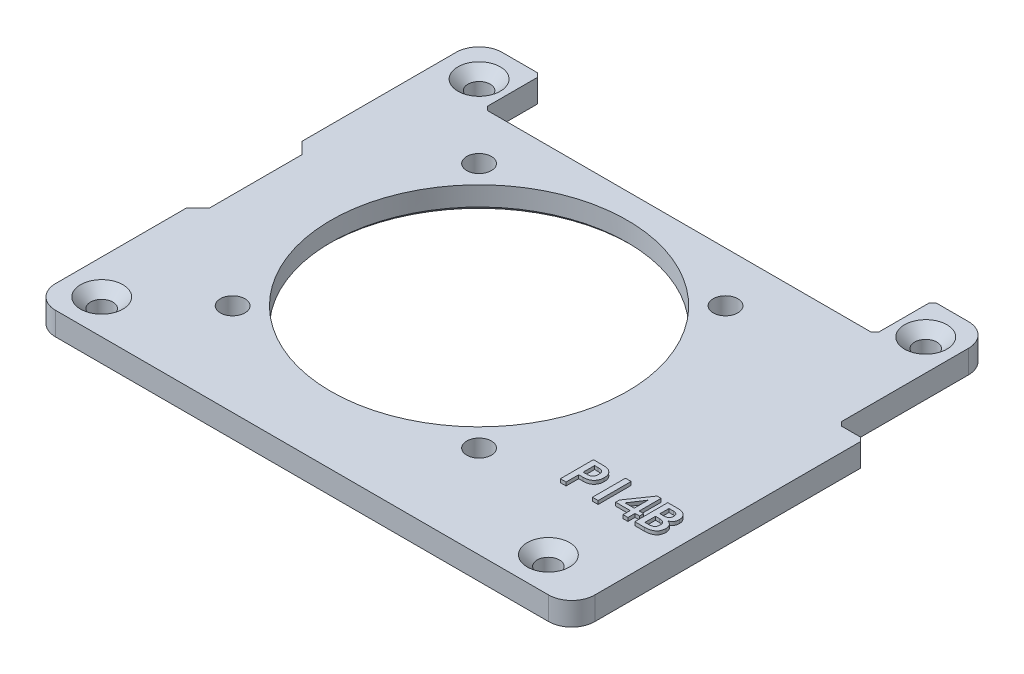
from build123d import *

# Parameters (mm, degrees)
EXTRUDE_1_DEPTH                = 3
HOLE_WIZARD_M2_5_1_D           = 2.9
HOLE_WIZARD_M2_5_1_CSINK_D     = 5.5
HOLE_WIZARD_M2_5_1_CSINK_ANGLE = 90
SKETCH_7_W                     = 50.8
SKETCH_7_H                     = 7.5
CUT_EXTRUDE_1_DEPTH            = 91.979123429
SKETCH_8_R                     = 19.25
SKETCH_8_R_2                   = 1.6
CUT_EXTRUDE_2_DEPTH            = 91.979123429
FILLET_2_R                     = 3
CHAMFER_1_SIZE                 = 0.5
CHAMFER_2_SIZE                 = 0.5
SKETCH_9_W                     = 1.5
SKETCH_9_H                     = 15
CUT_EXTRUDE_3_DEPTH            = 91.979123429
CHAMFER_3_SIZE                 = 1.5
SKETCH_10_W                    = 0.736350545
SKETCH_10_H                    = 4.28296778
EXTRUDE_2_DEPTH                = 0.45


with BuildPart() as part:
    # 草图1 → 凸台-拉伸1 (new body)
    with BuildSketch(Plane(origin=(0, 0, 0), x_dir=(1, 0, 0), z_dir=(0, 1, 0))):
        Polygon((70.03, 0), (70.03, 38), (66.55, 38), (66.55, 58), (0, 58), (0, 0), align=None)
    extrude(amount=EXTRUDE_1_DEPTH)

    # M2.5 锥坑平头螺钉的锥形沉头孔1 (through all)
    with Locations(Plane(origin=(0, 3, 0), x_dir=(1, 0, 0), z_dir=(0, 1, 0))):
        with Locations((4.5, 4.5), (4.5, 53.5), (62.5, 53.5), (62.5, 4.5)):
            CounterSinkHole(HOLE_WIZARD_M2_5_1_D / 2, HOLE_WIZARD_M2_5_1_CSINK_D / 2, counter_sink_angle=HOLE_WIZARD_M2_5_1_CSINK_ANGLE)

    # 草图7 → 切除-拉伸1 (cut, through all)
    with BuildSketch(Plane(origin=(0, 3, 0), x_dir=(1, 0, 0), z_dir=(0, 1, 0))):
        with Locations((33.5, 54.25)):
            Rectangle(SKETCH_7_W, SKETCH_7_H)
    extrude(amount=-CUT_EXTRUDE_1_DEPTH, mode=Mode.SUBTRACT)

    # 草图8 → 切除-拉伸2 (cut, through all)
    with BuildSketch(Plane(origin=(0, 3, 0), x_dir=(1, 0, 0), z_dir=(0, 1, 0))):
        with Locations(Location((30, 28, 0), (0, 0, 270))):
            Circle(SKETCH_8_R)
        with Locations(Location((14, 44, 0), (0, 0, 270))):
            Circle(SKETCH_8_R_2)
        with Locations(Location((46, 44, 0), (0, 0, 270))):
            Circle(SKETCH_8_R_2)
        with Locations(Location((14, 12, 0), (0, 0, 270))):
            Circle(SKETCH_8_R_2)
        with Locations(Location((46, 12, 0), (0, 0, 270))):
            Circle(SKETCH_8_R_2)
    extrude(amount=-CUT_EXTRUDE_2_DEPTH, mode=Mode.SUBTRACT)

    # 圆角2
    fillet_2_edges = [part.edges().sort_by_distance(p)[0] for p in [
        (0, 1.5, -58),
        (66.55, 1.5, -58),
        (70.03, 1.5, 0),
        (0, 1.5, 0),
    ]]
    fillet(fillet_2_edges, radius=FILLET_2_R)

    # 倒角1
    chamfer_1_edges = [part.edges().sort_by_distance(p)[0] for p in [
        (66.55, 1.5, -38),
        (70.03, 1.5, -38),
        (8.1, 1.5, -50.5),
        (8.1, 1.5, -58),
        (58.9, 1.5, -58),
        (58.9, 1.5, -50.5),
    ]]
    chamfer(chamfer_1_edges, length=CHAMFER_1_SIZE)

    # 倒角2
    chamfer_2_edges = [part.edges().sort_by_distance(p)[0] for p in [
        (30, 0, -47.25),
    ]]
    chamfer(chamfer_2_edges, length=CHAMFER_2_SIZE)

    # 草图9 → 切除-拉伸3 (cut, through all)
    with BuildSketch(Plane(origin=(0, 3, 0), x_dir=(1, 0, 0), z_dir=(0, 1, 0))):
        with Locations((0.75, 27.5)):
            Rectangle(SKETCH_9_W, SKETCH_9_H)
    extrude(amount=-CUT_EXTRUDE_3_DEPTH, mode=Mode.SUBTRACT)

    # 倒角3
    chamfer_3_edges = [part.edges().sort_by_distance(p)[0] for p in [
        (1.5, 1.5, -20),
        (1.5, 1.5, -35),
    ]]
    chamfer(chamfer_3_edges, length=CHAMFER_3_SIZE - 0.0001)  # a hair under: the kernel refuses the full size

    # 草图10 → 凸台-拉伸2 (add)
    # profile 1 of 4: a face of its own
    with BuildSketch(Plane(origin=(0, 3, 0), x_dir=(1, 0, 0), z_dir=(0, 1, 0))):
        with BuildLine():
            add(Edge.make_bspline(
                [(57.909075927, 16.34371961), (57.908149164, 16.295550669), (57.906330534, 16.201026562), (57.888155166, 16.062953132), (57.860253997, 15.931625506), (57.81949143, 15.807891256), (57.767618475, 15.691257064), (57.705173618, 15.581114679), (57.629827056, 15.478471088), (57.5436965, 15.383172643), (57.447425045, 15.296541062), (57.340774288, 15.221349211), (57.223860837, 15.158726364), (57.097414295, 15.10743544), (56.961738841, 15.066715289), (56.81634825, 15.038838133), (56.66175021, 15.020790382), (56.555322858, 15.019015364), (56.500725071, 15.01810477)],
                knots=[0, 0, 0, 0, 1.055941234, 2.072121589, 3.048957332, 3.996857081, 4.923552649, 5.844699312, 6.768221172, 7.710385292, 8.657546142, 9.602916946, 10.565193964, 11.559900134, 12.591170482, 13.666713964, 14.803012066, 16, 16, 16, 16], degree=3))
            Line((56.500725071, 15.01810477), (55.911460777, 15.01810477))
            Line((55.911460777, 15.01810477), (55.911460777, 13.38636667))
            Line((55.911460777, 13.38636667), (55.175110231, 13.38636667))
            Line((55.175110231, 13.38636667), (55.175110231, 17.66933445))
            Line((55.175110231, 17.66933445), (56.500725071, 17.66933445))
            add(Edge.make_bspline(
                [(56.500725071, 17.66933445), (56.555322758, 17.668423422), (56.661749915, 17.666647558), (56.816349336, 17.648605799), (56.961735073, 17.620707569), (57.09715551, 17.580142798), (57.223428003, 17.528680492), (57.33960435, 17.465023774), (57.446545308, 17.390043228), (57.542748872, 17.30331987), (57.628980647, 17.208093731), (57.704086938, 17.105132323), (57.767806232, 16.995546782), (57.819420831, 16.878588865), (57.860281159, 16.754906452), (57.888055184, 16.623857602), (57.906388549, 16.486115374), (57.90816681, 16.391890869), (57.909075927, 16.34371961)],
                knots=[0, 0, 0, 0, 1.197461093, 2.334208364, 3.410176999, 4.441854999, 5.43073401, 6.396602736, 7.342347237, 8.289882492, 9.232419041, 10.156305961, 11.081170954, 12.008232837, 12.956507283, 13.93372916, 14.943641362, 16, 16, 16, 16], degree=3))
        make_face()
        with BuildLine():
            add(Edge.make_bspline(
                [(57.172725381, 16.34371961), (57.172411975, 16.378376569), (57.171808617, 16.44509682), (57.161246686, 16.540617665), (57.145802096, 16.627597671), (57.125286604, 16.706538706), (57.096856996, 16.776715492), (57.061814536, 16.837897871), (57.020965378, 16.890632378), (56.972944383, 16.934326077), (56.918793051, 16.971714381), (56.857334845, 17.002317059), (56.790359376, 17.030333187), (56.716079656, 17.052305783), (56.635084639, 17.068368716), (56.547582267, 17.08020363), (56.453354479, 17.087628975), (56.3882796, 17.0887053), (56.354558109, 17.089263046)],
                knots=[0, 0, 0, 0, 1.287087184, 2.477851002, 3.56551051, 4.568137571, 5.502703185, 6.369845782, 7.180743627, 7.970419851, 8.772637866, 9.617977299, 10.516617182, 11.467615524, 12.490341929, 13.582105939, 14.747058877, 16, 16, 16, 16], degree=3))
            Line((56.354558109, 17.089263046), (55.911460777, 17.089263046))
            Line((55.911460777, 17.089263046), (55.911460777, 15.599095463))
            Line((55.911460777, 15.599095463), (56.354558109, 15.599095463))
            add(Edge.make_bspline(
                [(56.354558109, 15.599095463), (56.388278429, 15.599665013), (56.453656556, 15.600769277), (56.548203866, 15.608086485), (56.635990612, 15.620025206), (56.717042911, 15.635946927), (56.791020705, 15.658345242), (56.858294388, 15.684645548), (56.918928425, 15.716067179), (56.972967431, 15.753064721), (57.020959075, 15.796820085), (57.061816371, 15.849537493), (57.096856448, 15.910724879), (57.125286768, 15.980900171), (57.145802047, 16.059841652), (57.161246701, 16.146821523), (57.171808613, 16.242342408), (57.172411974, 16.309062654), (57.172725381, 16.34371961)],
                knots=[0, 0, 0, 0, 1.253177668, 2.4297043, 3.521674426, 4.544593913, 5.495771796, 6.390314524, 7.225705931, 8.028075398, 8.817900706, 9.628951643, 10.496257949, 11.431000001, 12.433816351, 13.5216812, 14.712669824, 16, 16, 16, 16], degree=3))
        make_face(mode=Mode.SUBTRACT)
    # profile 2 of 4: a face of its own
    with BuildSketch(Plane(origin=(0, 3, 0), x_dir=(1, 0, 0), z_dir=(0, 1, 0))):
        with Locations((59.704907127, 15.52785056)):
            Rectangle(SKETCH_10_W, SKETCH_10_H)
    # profile 3 of 4: a face of its own
    with BuildSketch(Plane(origin=(0, 3, 0), x_dir=(1, 0, 0), z_dir=(0, 1, 0))):
        Polygon((63.278643388, 14.33599228), (61.403293684, 14.33599228), (61.403293684, 14.827811933), (63.403666702, 17.71805677), (63.918468581, 17.71805677), (63.918468581, 14.868260652), (64.50313643, 14.868260652), (64.50313643, 14.33599228), (63.918468581, 14.33599228), (63.918468581, 13.410268186), (63.278643388, 13.410268186), align=None)
        Polygon((63.278643388, 14.868260652), (63.278643388, 16.674663675), (62.090921909, 14.868260652), align=None, mode=Mode.SUBTRACT)
    # profile 4 of 4: a face of its own
    with BuildSketch(Plane(origin=(0, 3, 0), x_dir=(1, 0, 0), z_dir=(0, 1, 0))):
        with BuildLine():
            add(Edge.make_bspline(
                [(67.616768512, 14.687160705), (67.61570754, 14.629486875), (67.61365747, 14.518046359), (67.593100612, 14.35768385), (67.560326172, 14.210387533), (67.514883931, 14.07600626), (67.45482098, 13.955399642), (67.381442102, 13.848382804), (67.295142895, 13.754101714), (67.194994795, 13.674446549), (67.084824838, 13.606899619), (66.967446319, 13.548069667), (66.843281975, 13.496917898), (66.710945005, 13.457244801), (66.571745424, 13.424229105), (66.424630521, 13.40338733), (66.270306161, 13.388715117), (66.164942186, 13.387162134), (66.110973015, 13.38636667)],
                knots=[0, 0, 0, 0, 1.214216004, 2.346174309, 3.398354795, 4.388279313, 5.326350126, 6.226833345, 7.112954168, 8.008031957, 8.912461697, 9.830332446, 10.771174523, 11.736815783, 12.73722573, 13.781438273, 14.863615984, 16, 16, 16, 16], degree=3))
            Line((66.110973015, 13.38636667), (64.834080496, 13.38636667))
            Line((64.834080496, 13.38636667), (64.834080496, 17.66933445))
            Line((64.834080496, 17.66933445), (66.159695336, 17.66933445))
            add(Edge.make_bspline(
                [(66.159695336, 17.66933445), (66.214267317, 17.668215827), (66.319969411, 17.666049134), (66.47329545, 17.651108459), (66.615314185, 17.62265873), (66.747760168, 17.587212966), (66.868568972, 17.537839445), (66.979146143, 17.479176573), (67.078528599, 17.408596263), (67.166182053, 17.327717191), (67.242848004, 17.240189149), (67.310688354, 17.149822573), (67.36799805, 17.056075901), (67.41404831, 16.958443667), (67.451296665, 16.858393733), (67.477195494, 16.754511299), (67.491815743, 16.647503867), (67.494213207, 16.575116889), (67.495422355, 16.538608893)],
                knots=[0, 0, 0, 0, 1.33113717, 2.578319164, 3.750959862, 4.860775065, 5.916972853, 6.926855544, 7.90778062, 8.88113087, 9.828922234, 10.742256505, 11.634396839, 12.503607127, 13.37140239, 14.234259165, 15.109457783, 16, 16, 16, 16], degree=3))
            add(Edge.make_bspline(
                [(67.495422355, 16.538608893), (67.494678703, 16.502731817), (67.493232814, 16.432975717), (67.483138787, 16.331532118), (67.46629843, 16.236916962), (67.440689606, 16.149518079), (67.410484282, 16.068486993), (67.37095319, 15.995275896), (67.326039069, 15.92811808), (67.257526088, 15.851685264), (67.169107808, 15.772178145), (67.064280594, 15.696200089), (66.96313452, 15.643071194), (66.894339174, 15.627535044), (66.862032185, 15.620239111)],
                knots=[0, 0, 0, 0, 1.066354622, 2.073322247, 3.027359755, 3.918209834, 4.777534225, 5.592506442, 6.385810961, 7.17328942, 8.6370913, 9.910926524, 11.018950027, 12, 12, 12, 12], degree=3))
            add(Edge.make_bspline(
                [(66.862032185, 15.620239111), (66.904822235, 15.611449278), (66.993284672, 15.593277526), (67.121520403, 15.532212149), (67.248059385, 15.445145798), (67.348791353, 15.35361149), (67.426908321, 15.270593261), (67.476848077, 15.200053054), (67.521207014, 15.126206898), (67.555417576, 15.046761355), (67.583706987, 14.963613217), (67.602525886, 14.875363896), (67.614993063, 14.78281941), (67.616170544, 14.719378385), (67.616768512, 14.687160705)],
                knots=[0, 0, 0, 0, 1.203910315, 2.488916061, 3.891524143, 5.439134463, 6.242555454, 7.037221142, 7.823170937, 8.619595385, 9.423194974, 10.247336316, 11.109933089, 12, 12, 12, 12], degree=3))
        make_face()
        with BuildLine():
            add(Edge.make_bspline(
                [(66.75815252, 16.538608893), (66.757581369, 16.56191634), (66.756481144, 16.606814099), (66.74924731, 16.671783012), (66.736526395, 16.731919657), (66.718115391, 16.787014699), (66.695168224, 16.837596772), (66.66625063, 16.882656218), (66.633365992, 16.923895066), (66.580829557, 16.970023268), (66.507940593, 17.018799451), (66.40853923, 17.059628717), (66.299464506, 17.084907002), (66.222962485, 17.087783095), (66.183596851, 17.089263046)],
                knots=[0, 0, 0, 0, 0.927142937, 1.785980239, 2.596484439, 3.367432301, 4.092799605, 4.799595254, 5.492591191, 6.183009329, 7.572534581, 8.960294269, 10.435859072, 12, 12, 12, 12], degree=3))
            Line((66.183596851, 17.089263046), (65.570431041, 17.089263046))
            Line((65.570431041, 17.089263046), (65.570431041, 15.915330903))
            Line((65.570431041, 15.915330903), (66.159695336, 15.915330903))
            add(Edge.make_bspline(
                [(66.159695336, 15.915330903), (66.199384094, 15.91706662), (66.276941827, 15.920458468), (66.388622326, 15.947905328), (66.491635758, 15.992337552), (66.568763265, 16.044821853), (66.624367627, 16.095598578), (66.66041652, 16.141324891), (66.690665799, 16.193124318), (66.715499633, 16.250567951), (66.73501978, 16.314041726), (66.748287909, 16.3837133), (66.756718832, 16.459343836), (66.757664351, 16.511619252), (66.75815252, 16.538608893)],
                knots=[0, 0, 0, 0, 1.451379929, 2.836212108, 4.182481497, 5.538993073, 6.229475639, 6.931972211, 7.661100203, 8.419662085, 9.217987839, 10.086952726, 11.012299424, 12, 12, 12, 12], degree=3))
        make_face(mode=Mode.SUBTRACT)
        with BuildLine():
            add(Edge.make_bspline(
                [(66.855597162, 14.687160705), (66.854923952, 14.715693764), (66.853615588, 14.771146863), (66.842637138, 14.851002446), (66.824290271, 14.924434732), (66.798844652, 14.991134297), (66.764967583, 15.050895895), (66.72473564, 15.104645482), (66.676092482, 15.151252516), (66.601721975, 15.203149139), (66.500349423, 15.256779292), (66.369272341, 15.301423649), (66.230521721, 15.330444728), (66.1350243, 15.333629599), (66.08615221, 15.335259499)],
                knots=[0, 0, 0, 0, 0.89950437, 1.748158365, 2.535631478, 3.282137647, 3.991705508, 4.695193889, 5.392281939, 6.105590437, 7.549383668, 8.991818094, 10.460522455, 12, 12, 12, 12], degree=3))
            Line((66.08615221, 15.335259499), (65.570431041, 15.335259499))
            Line((65.570431041, 15.335259499), (65.570431041, 13.966438073))
            Line((65.570431041, 13.966438073), (66.013528373, 13.966438073))
            add(Edge.make_bspline(
                [(66.013528373, 13.966438073), (66.047556679, 13.966991267), (66.11324434, 13.968059142), (66.208685456, 13.975575809), (66.297427715, 13.987246975), (66.379940527, 14.003450039), (66.455494844, 14.025650206), (66.524779016, 14.052210379), (66.587916186, 14.083384568), (66.644758235, 14.120312401), (66.695072755, 14.164037988), (66.739121621, 14.215047158), (66.774713926, 14.275237189), (66.805337157, 14.342224546), (66.827924365, 14.417768237), (66.844511754, 14.50052442), (66.853181103, 14.591373618), (66.854769745, 14.654356921), (66.855597162, 14.687160705)],
                knots=[0, 0, 0, 0, 1.269965571, 2.451519813, 3.57082322, 4.609321398, 5.586495255, 6.506157291, 7.375666785, 8.209937576, 9.028698946, 9.856121335, 10.713282766, 11.629524913, 12.599038758, 13.648749371, 14.775391023, 16, 16, 16, 16], degree=3))
        make_face(mode=Mode.SUBTRACT)
    extrude(amount=EXTRUDE_2_DEPTH)


solid = part.part
